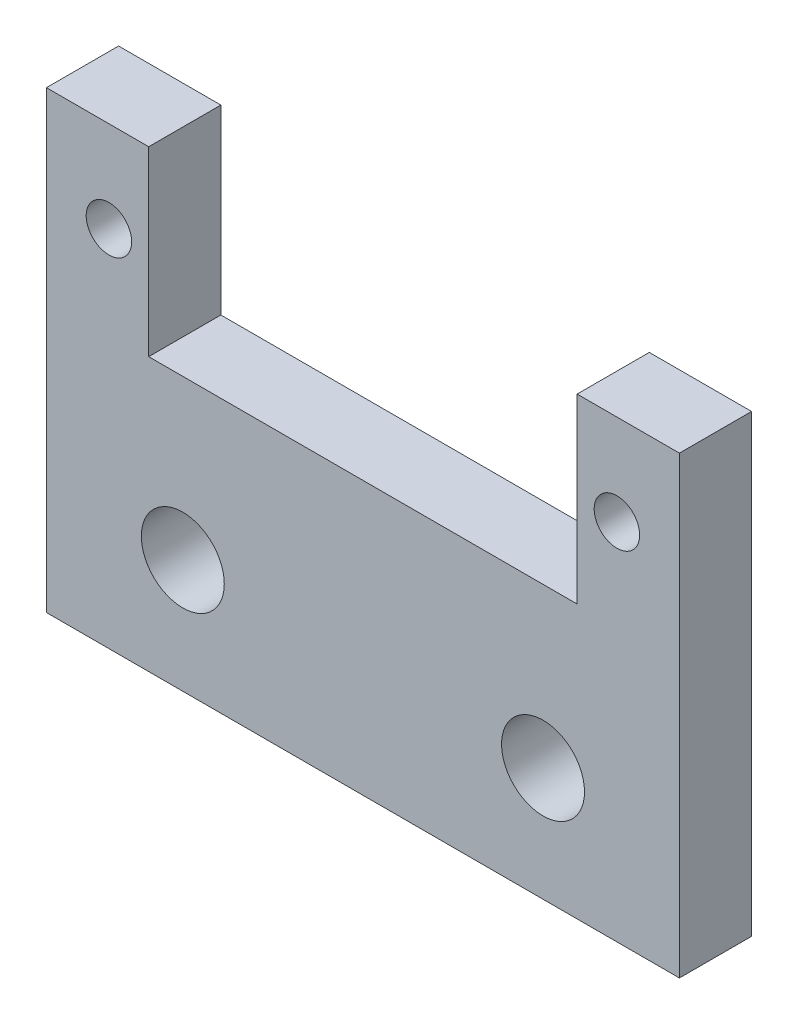
from build123d import *

# Parameters (mm, degrees)
SKETCH1_R           = 1
SKETCH1_R_2         = 1.825
BOSS_EXTRUDE1_DEPTH = 3.175


with BuildPart() as part:
    # Sketch1 → Boss-Extrude1 (new body)
    with BuildSketch(Plane.XY):
        Polygon((0, 8), (0, 0), (0, -12), (27.85, -12), (27.85, 8), (23.35, 8), (23.35, 0), (4.5, 0), (4.5, 8), align=None)
        with Locations((2.75, 4)):
            Circle(SKETCH1_R, mode=Mode.SUBTRACT)
        with Locations((25.1, 4)):
            Circle(SKETCH1_R, mode=Mode.SUBTRACT)
        with Locations((6, -7)):
            Circle(SKETCH1_R_2, mode=Mode.SUBTRACT)
        with Locations((21.85, -7)):
            Circle(SKETCH1_R_2, mode=Mode.SUBTRACT)
    extrude(amount=BOSS_EXTRUDE1_DEPTH)


solid = part.part
